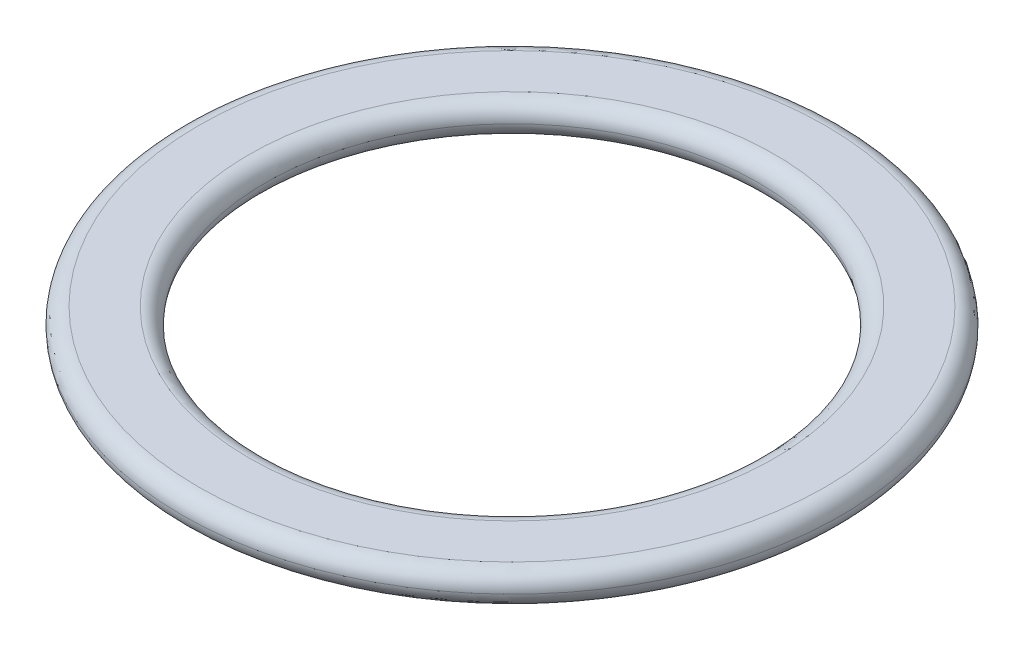
from build123d import *

# Parameters (mm, degrees)
IZIM1_R                     = 12.31
Y_KSEKLIK_EKSTR_ZYON1_DEPTH = 1.21
RADYUS1_R                   = 0.61
RADYUS2_R                   = 0.61
KES_EKSTR_ZYON1_DEPTH       = 1.21
KES_EKSTR_ZYON1_DEPTH_BACK  = 11
IZIM2_R                     = 9.21
RADYUS3_R                   = 0.61
RADYUS4_R                   = 0.61


with BuildPart() as part:
    # Çizim1 → Yükseklik-Ekstrüzyon1 (new body)
    with BuildSketch(Plane(origin=(0, 0, 0), x_dir=(1, 0, 0), z_dir=(0, 1, 0))):
        with Locations(Location((0, 0, 0), (0, 0, 90))):
            Circle(IZIM1_R)
    extrude(amount=Y_KSEKLIK_EKSTR_ZYON1_DEPTH)

    # Radyus1
    radyus1_edges = [part.edges().sort_by_distance(p)[0] for p in [
        (0, 1.21, 12.31),
    ]]
    fillet(radyus1_edges, radius=RADYUS1_R)

    # Radyus2
    # the kernel refuses this fillet: 0.61 mm, written as the material it takes off along each edge
    with BuildSketch(Plane(origin=(0, 0, 0), x_dir=(0, 0, -1), z_dir=(1, 0, 0))) as radyus2_piece_1:
        with BuildLine():
            CenterArc((12.31 - RADYUS2_R, RADYUS2_R), RADYUS2_R, 270, 90)
            Line((12.31 - RADYUS2_R, 0), (12.31, 0))
            Line((12.31, 0), (12.31, RADYUS2_R))
        make_face()
    revolve(axis=Axis((0, 0, 0), (0, 1, 0)), mode=Mode.SUBTRACT)

    # Çizim2 → Kes-Ekstrüzyon1 (cut, two sides: drawn at the far end of the back side and taken through both)
    with BuildSketch(Plane(origin=(0, 1.21, 0), x_dir=(1, 0, 0), z_dir=(0, 1, 0)).offset(-KES_EKSTR_ZYON1_DEPTH_BACK)):
        with Locations(Location((0, 0, 0), (0, 0, 270))):
            Circle(IZIM2_R)
    extrude(amount=KES_EKSTR_ZYON1_DEPTH + KES_EKSTR_ZYON1_DEPTH_BACK, mode=Mode.SUBTRACT)

    # Radyus3
    radyus3_edges = [part.edges().sort_by_distance(p)[0] for p in [
        (0, 1.21, -9.21),
    ]]
    fillet(radyus3_edges, radius=RADYUS3_R)

    # Radyus4
    # the kernel refuses this fillet: 0.61 mm, written as the material it takes off along each edge
    with BuildSketch(Plane(origin=(0, 0, 0), x_dir=(0, 0, 1), z_dir=(-1, 0, 0))) as radyus4_piece_1:
        with BuildLine():
            CenterArc((9.21 + RADYUS4_R, RADYUS4_R), RADYUS4_R, 180, 90)
            Line((9.21 + RADYUS4_R, 0), (9.21, 0))
            Line((9.21, 0), (9.21, RADYUS4_R))
        make_face()
    revolve(axis=Axis((0, 0, 0), (0, 1, 0)), mode=Mode.SUBTRACT)


solid = part.part
